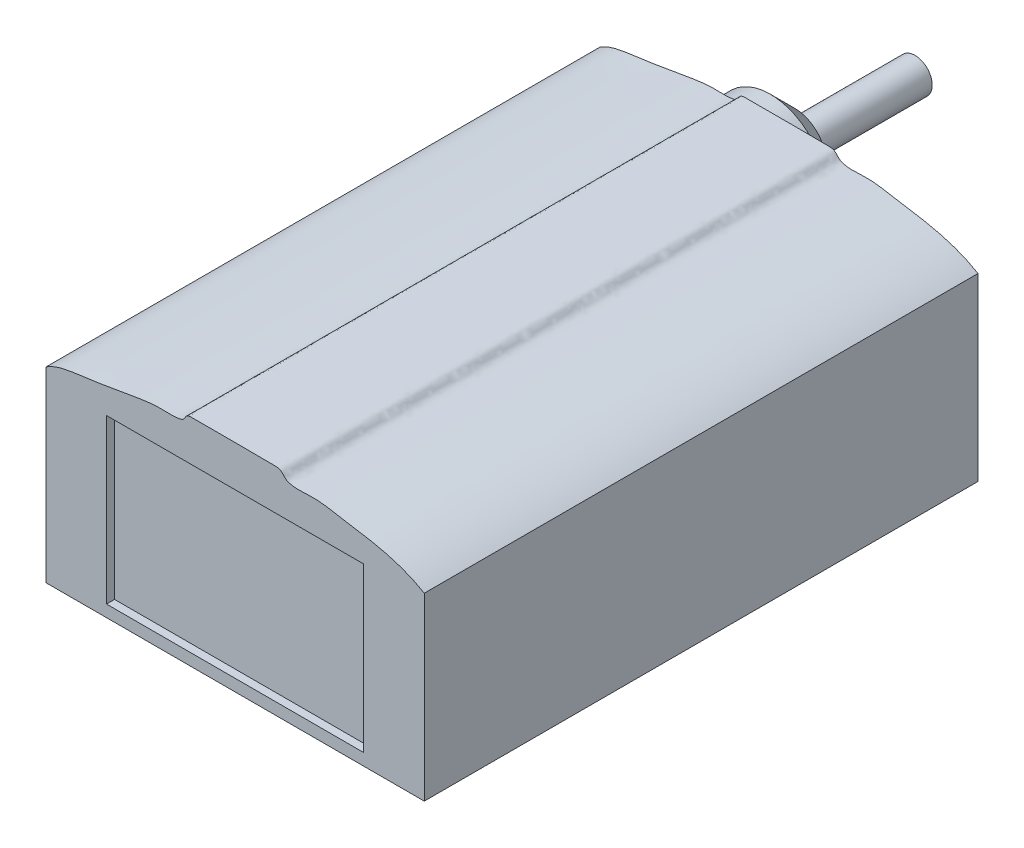
from build123d import *

# Parameters (mm, degrees)
EXTRUDE_1_DEPTH     = 68.9
SKETCH_3_R          = 6.95
EXTRUDE_2_DEPTH     = 12.8
CHAMFER_1_SIZE      = 3
SKETCH_4_R          = 2.135783825
EXTRUDE_3_DEPTH     = 15
SKETCH_5_W          = 32
SKETCH_5_H          = 20.32
CUT_EXTRUDE_1_DEPTH = 1


with BuildPart() as part:
    # Эскиз2 → Бобышка-Вытянуть1 (new body)
    with BuildSketch(Plane.XY):
        with BuildLine():
            Line((-188.051942113, -83.264171007), (-188.051942113, -106.521233953))
            Line((-188.051942113, -106.521233953), (-140.981942113, -106.521233953))
            Line((-140.981942113, -106.521233953), (-140.981942113, -84.109678038))
            add(Edge.make_bspline(
                [(-188.051942113, -83.264171007), (-186.751441625, -82.400103478), (-184.014745849, -82.098183961), (-180.269750478, -81.539300961), (-177.11443979, -80.966837329), (-174.129855052, -80.48790743), (-172.311248735, -80.726415641), (-170.781028922, -80.402149956), (-170.710950221, -79.66797894), (-168.676391514, -79.597454114), (-161.911227506, -79.674730736), (-158.755920697, -79.661056202), (-158.33866764, -80.450107039), (-156.859894774, -80.952439076), (-154.650535556, -80.50071138), (-151.070724866, -81.26707385), (-146.373565536, -81.897295087), (-142.926815312, -82.951640991), (-140.981942113, -84.109678038)],
                knots=[0, 0, 0, 0, 0.130688839, 0.231656249, 0.325449039, 0.407810964, 0.483444576, 0.495515392, 0.52485204, 0.540813638, 0.639169778, 0.65366229, 0.671246246, 0.679565076, 0.734652601, 0.804528184, 0.874806899, 1, 1, 1, 1], degree=3))
        make_face()
    extrude(amount=EXTRUDE_1_DEPTH)

    # Эскиз3 → Бобышка-Вытянуть2 (add)
    with BuildSketch(Plane(origin=(0, 0, 0), x_dir=(-1, 0, 0), z_dir=(0, 0, -1))):
        with Locations((176.611079589, -94.458123157)):
            Circle(SKETCH_3_R)
    extrude(amount=EXTRUDE_2_DEPTH)

    # Фаска1
    chamfer_1_edges = [part.edges().sort_by_distance(p)[0] for p in [
        (-169.661079589, -94.458123157, -12.8),
    ]]
    chamfer(chamfer_1_edges, length=CHAMFER_1_SIZE)

    # Эскиз4 → Бобышка-Вытянуть3 (add)
    with BuildSketch(Plane(origin=(0, 0, -12.8), x_dir=(-1, 0, 0), z_dir=(0, 0, -1))):
        with Locations((176.611079589, -94.458123157)):
            Circle(SKETCH_4_R)
    extrude(amount=EXTRUDE_3_DEPTH)

    # Эскиз5 → Вырез-Вытянуть1 (cut)
    with BuildSketch(Plane.XY.offset(68.9)):
        with Locations((-164.516942113, -94.89270248)):
            Rectangle(SKETCH_5_W, SKETCH_5_H)
    extrude(amount=-CUT_EXTRUDE_1_DEPTH, mode=Mode.SUBTRACT)


solid = part.part
